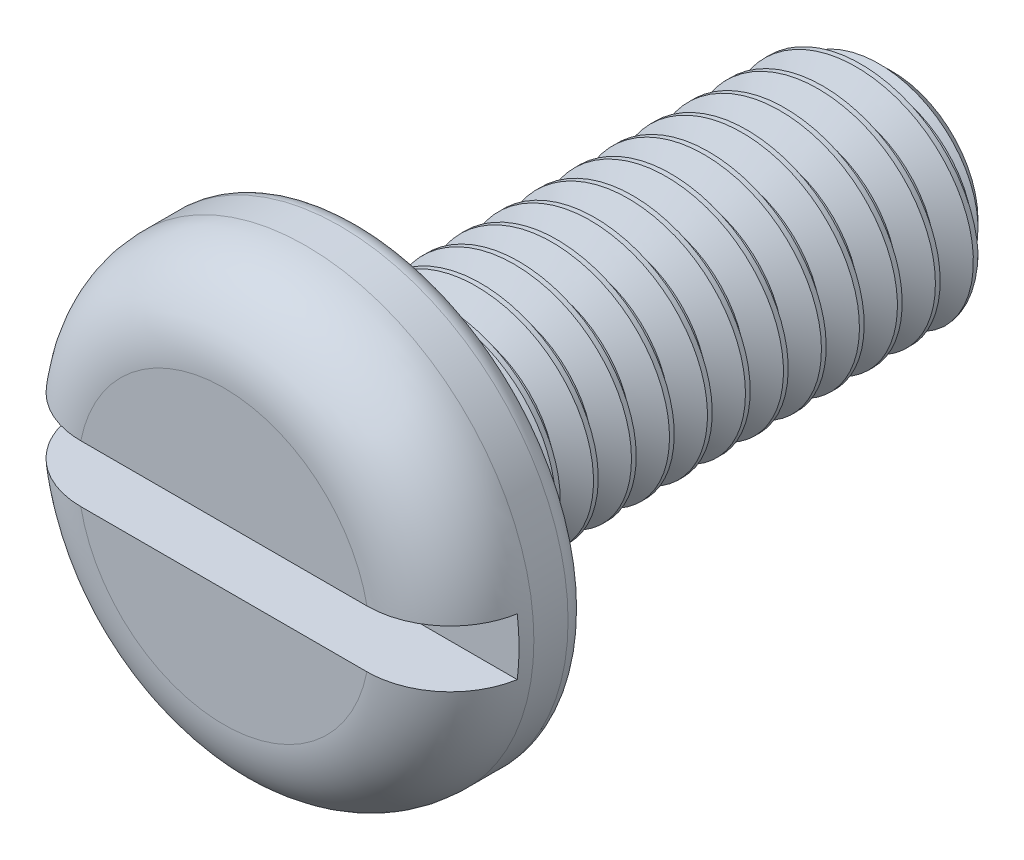
from build123d import *

# Parameters (mm, degrees)
SKETCH1_R          = 6
EXTRUDE3_DEPTH     = 3.6
SKETCH4_W          = 14
SKETCH4_H          = 3
CHAMFER1_SIZE      = 0.75
CUT_SWEEP1_PITCH   = 1
CUT_SWEEP1_TO      = 14
SKETCH12_W         = 12
SKETCH12_H         = 1.5
CUT_EXTRUDE1_DEPTH = 1.8
FILLET1_R          = 0.54


with BuildPart() as part:
    # Sketch1 → Extrude3 (new body)
    with BuildSketch(Plane.XY):
        Circle(SKETCH1_R)
    extrude(amount=EXTRUDE3_DEPTH)

    # Sketch11 → Cut-Revolve3 (revolve, cut)
    with BuildSketch(Plane(origin=(0, 0, 0), x_dir=(0, 0, -1), z_dir=(1, 0, 0))):
        with BuildLine():
            Line((-3.6, 3.84), (-3.8, 3.84))
            Line((-3.8, 3.84), (-3.8, 6.2))
            Line((-3.8, 6.2), (0, 6.2))
            Line((0, 6.2), (0, 6))
            Line((0, 6), (-1.44, 6))
            ThreePointArc((-1.44, 6), (-2.967350647, 5.367350647), (-3.6, 3.84))
        make_face()
    revolve(axis=Axis((0, 0, -0.441444004), (0, 0, 1)), mode=Mode.SUBTRACT)

    # Sketch12 → Cut-Extrude1 (cut)
    with BuildSketch(Plane.XY.offset(3.6)):
        Rectangle(SKETCH12_W, SKETCH12_H)
    extrude(amount=-CUT_EXTRUDE1_DEPTH, mode=Mode.SUBTRACT)

    # Fillet1
    fillet1_edges = [part.edges().sort_by_distance(p)[0] for p in [
        (-6, 0, 0),
    ]]
    fillet(fillet1_edges, radius=FILLET1_R)


with BuildPart() as body_2:
    # Sketch4 → Revolve1 (revolve)
    with BuildSketch(Plane(origin=(0, 0, 0), x_dir=(0, 0, -1), z_dir=(1, 0, 0)), mode=Mode.PRIVATE) as revolve1_sk:
        with Locations((7, 1.5)):
            Rectangle(SKETCH4_W, SKETCH4_H)
    revolve(revolve1_sk.sketch.rotate(Axis((0, 0, -14), (0, 0, -1)), 90), axis=Axis((0, 0, -14), (0, 0, -1)))

    # Chamfer1
    chamfer1_edges = [body_2.edges().sort_by_distance(p)[0] for p in [
        (-3, 0, -14),
    ]]
    chamfer(chamfer1_edges, length=CHAMFER1_SIZE)

    # Cut-Sweep1: arcs per turn and ends read off the stored shape
    # Cut-Sweep1: the profile of Sketch13 profile screwed along a right-hand helix through 15 turns, 8 arcs to a turn; built about Z, then put on its axis
    cut_sweep1_z = Axis((0, 0, 0), (0, 0, 1))
    cut_sweep1_corners = [(3.0003, 0, -0.124826795), (2.350480947, 0, -0.5), (2.350480947, 0, -0.625), (3.0003, 0, -1.000173205)]
    with BuildLine(mode=Mode.PRIVATE) as cut_sweep1_profile:
        Line(cut_sweep1_corners[0], cut_sweep1_corners[1])
        Line(cut_sweep1_corners[1], cut_sweep1_corners[2])
        Line(cut_sweep1_corners[2], cut_sweep1_corners[3])
        Line(cut_sweep1_corners[3], cut_sweep1_corners[0])
    cut_sweep1_cap = Face(cut_sweep1_profile.wire())
    cut_sweep1_turn_angles = [0, 22.5, 45, 67.5, 90, 112.5, 135, 157.5, 180, 202.5, 225, 247.5, 270, 292.5, 315, 337.5, 360]
    cut_sweep1_turn_weights = [1, 0.9238795325112867, 1, 0.9238795325112867, 1, 0.9238795325112867, 1, 0.9238795325112867, 1, 0.9238795325112867, 1, 0.9238795325112867, 1, 0.9238795325112867, 1, 0.9238795325112867, 1]
    cut_sweep1_turn_rails = [Edge.make_bspline([Vector(p[0], p[1], 0).rotate(cut_sweep1_z, cut_sweep1_turn_angles[k]) / cut_sweep1_turn_weights[k] + Vector(0, 0, p[2] + CUT_SWEEP1_PITCH * cut_sweep1_turn_angles[k] / 360) for k in range(17)], [0, 0, 0, 1, 1, 2, 2, 3, 3, 4, 4, 5, 5, 6, 6, 7, 7, 8, 8, 8], 2, cut_sweep1_turn_weights) for p in cut_sweep1_corners]
    cut_sweep1_turn_sides = [Face.make_surface_from_curves(cut_sweep1_turn_rails[p[0]], cut_sweep1_turn_rails[p[1]]) for p in [(0, 1), (1, 2), (2, 3), (3, 0)]]
    cut_sweep1 = Plane(origin=(0, 0, -14), x_dir=(0.7071067811865512, 0.7071067811865438, 0), z_dir=(0, 0, 1)) * split(Solid(Shell([*[p.moved(Location((0, 0, CUT_SWEEP1_PITCH * i))) for i in range(15) for p in cut_sweep1_turn_sides], cut_sweep1_cap, cut_sweep1_cap.rotate(cut_sweep1_z, 5400).moved(Location((0, 0, CUT_SWEEP1_PITCH * 5400 / 360)))])), bisect_by=Plane.XY.offset(CUT_SWEEP1_TO), keep=Keep.BOTTOM, mode=Mode.PRIVATE)
    add(cut_sweep1, mode=Mode.SUBTRACT)


solid = Compound([part.part, body_2.part])
